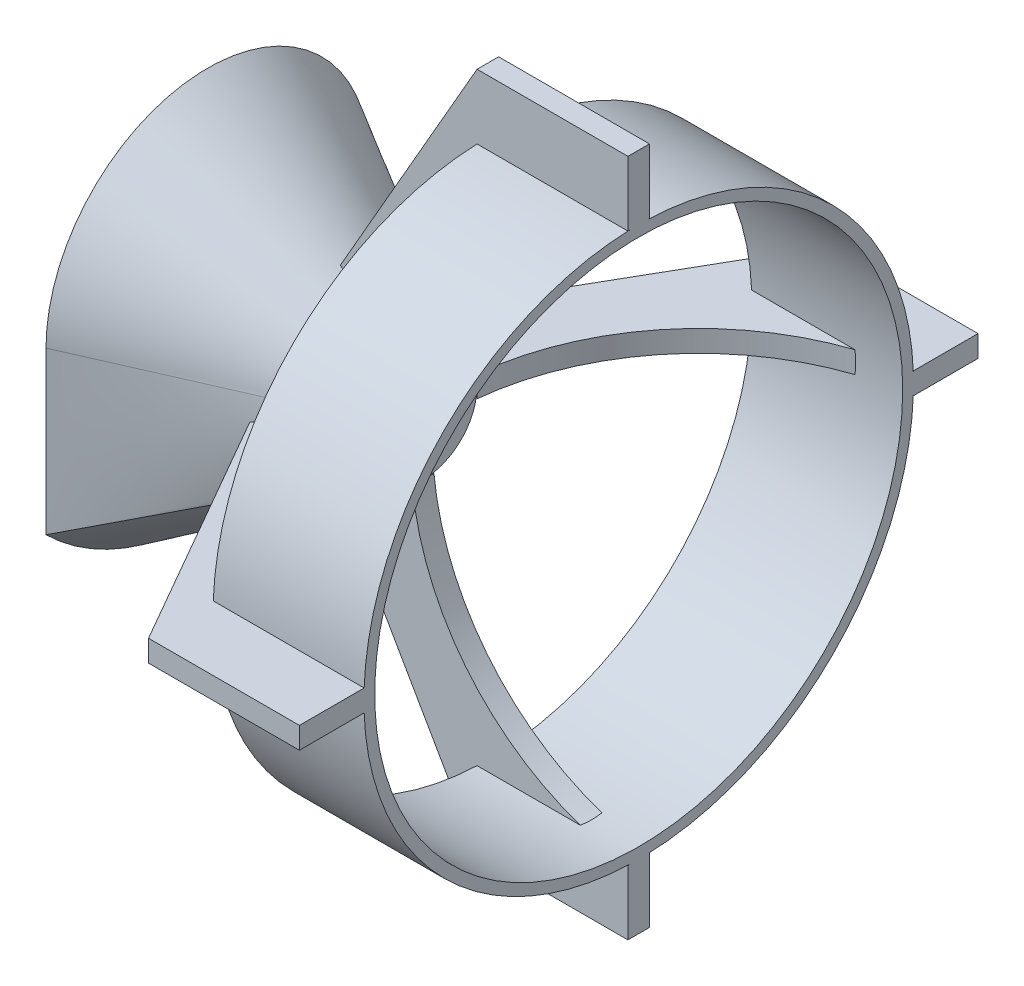
from build123d import *

# Parameters (mm, degrees)
SKETCH8_R           = 25.5
SKETCH8_R_2         = 24.5
EXTRUDE_THIN1_DEPTH = 14
BOSS_EXTRUDE1_DEPTH = 1
CIRPATTERN1_COUNT   = 4


with BuildPart() as part:
    # Loft1: read off the stored shape, not the designer's step
    # Loft1: loft between two sections, ruled curve by curve
    loft1_from = [
        Edge.make_bspline([(20, 13.884119326, -10.400460631), (20, 14.345391518, -10.597089845), (20, 15.195328634, -11.126083708), (20, 16.175313991, -12.233506959), (20, 16.78328052, -13.561588826), (20, 16.994259078, -15), (20, 16.78328052, -16.438411174), (20, 16.175313991, -17.766493041), (20, 15.195328634, -18.873916292), (20, 14.345391518, -19.402910155), (20, 13.557307439, -19.738851397), (20, 12.837113756, -19.962814883), (20, 11.625853413, -20.041350694), (20, 10.432245067, -19.820854414), (20, 9.743402629, -19.513714899), (20, 9.435250636, -19.336920671)], [0, 0, 0, 0, 0.092301972, 0.184603945, 0.276905917, 0.369207889, 0.461509862, 0.553811834, 0.646113807, 0.738415779, 0.738415779, 0.803811834, 0.869207889, 0.934603945, 1, 1, 1, 1], 3),
        Edge.make_bspline([(20, 9.435250636, -19.336920671), (20, 9.046894457, -19.114111369), (20, 8.344562773, -18.574155231), (20, 7.548269822, -17.531959041), (20, 7.043244004, -16.330021092), (20, 6.863547878, -15), (20, 7.043244004, -13.669978908), (20, 7.548269822, -12.468040959), (20, 8.344562773, -11.425844769), (20, 9.046894457, -10.885888631), (20, 9.435250636, -10.663079329)], [0, 0, 0, 0, 0.125, 0.25, 0.375, 0.5, 0.625, 0.75, 0.875, 1, 1, 1, 1], 3),
        Edge.make_bspline([(20, 9.435250636, -10.663079329), (20, 9.775163581, -10.468063077), (20, 10.490937064, -10.163384091), (20, 11.62623736, -9.96515353), (20, 12.776975019, -10.028438253), (20, 13.52362323, -10.246789836), (20, 13.884119326, -10.400460631)], [0, 0, 0, 0, 0.25, 0.5, 0.75, 1, 1, 1, 1], 3),
    ]
    loft1_to = [
        Edge.make_bspline([(0, 15, 0), (0, 16.911385838, 0), (0, 20.773082703, -0.740141475), (0, 25.789514326, -4.019447184), (0, 29.195998586, -9.028940674), (0, 30.402973243, -15), (0, 29.195998586, -20.971059326), (0, 25.789514326, -25.980552816), (0, 20.773082703, -29.259858525), (0, 16.911385838, -30), (0, 13.645780889, -30), (0, 11.111420032, -30), (0, 7.5, -30), (0, 3.888579968, -30), (0, 1.354219111, -30), (0, 0, -30)], [0, 0, 0, 0, 0.092301972, 0.184603945, 0.276905917, 0.369207889, 0.461509862, 0.553811834, 0.646113807, 0.738415779, 0.738415779, 0.803811834, 0.869207889, 0.934603945, 1, 1, 1, 1], 3),
        Edge.make_bspline([(0, 0, -30), (0, -1.02485849, -28.961005762), (0, -2.818360846, -26.724762965), (0, -4.739970514, -23.014326545), (0, -5.892936315, -19.066508643), (0, -6.277258249, -15), (0, -5.892936315, -10.933491357), (0, -4.739970514, -6.985673455), (0, -2.818360846, -3.275237035), (0, -1.02485849, -1.038994238), (0, 0, 0)], [0, 0, 0, 0, 0.125, 0.25, 0.375, 0.5, 0.625, 0.75, 0.875, 1, 1, 1, 1], 3),
        Edge.make_bspline([(0, 0, 0), (0, 1.25, 0), (0, 3.75, 0), (0, 7.5, 0), (0, 11.25, 0), (0, 13.75, 0), (0, 15, 0)], [0, 0, 0, 0, 0.25, 0.5, 0.75, 1, 1, 1, 1], 3),
    ]
    loft1 = Solid(Shell([*[Face.make_surface_from_curves(loft1_from[k], loft1_to[k]) for k in range(3)], Face(Wire(loft1_from)), Face(Wire(loft1_to))]))
    add(loft1)



with BuildPart() as body_2:
    # Sketch8 → Extrude-Thin1 (new body)
    with BuildSketch(Plane(origin=(26, 0, 0), x_dir=(0, 0, -1), z_dir=(1, 0, 0))):
        with Locations((15, 11.923446587)):
            Circle(SKETCH8_R)
        with Locations((15, 11.923446587)):
            Circle(SKETCH8_R_2, mode=Mode.SUBTRACT)
    extrude(amount=EXTRUDE_THIN1_DEPTH)


with BuildPart() as part_1:
    add(part.part)

    add(body_2.part)  # Boss-Extrude1 merges body 2
    # Sketch9 → Boss-Extrude1 (add, symmetric)
    with BuildSketch(Plane.XY.offset(-15)):
        with BuildLine():
            Line((40, 37.409249535), (40, 43.409249535))
            Line((40, 43.409249535), (26, 43.409249535))
            Line((26, 43.409249535), (13.306793698, 21.30019061))
            Line((13.306793698, 21.30019061), (20, 16.918297252))
            ThreePointArc((20, 16.918297252), (26.42246149, 30.65559599), (40, 37.409249535))
        make_face()
    boss_extrude1 = extrude(amount=BOSS_EXTRUDE1_DEPTH, both=True)

    # CirPattern1: Boss-Extrude1 ×4 about axis
    cirpattern1_axis = Axis((0, 11.923446587, -15), (1, 0, 0))
    for i in range(1, CIRPATTERN1_COUNT):
        add(boss_extrude1.rotate(cirpattern1_axis, i * 360 / CIRPATTERN1_COUNT))


solid = part_1.part
